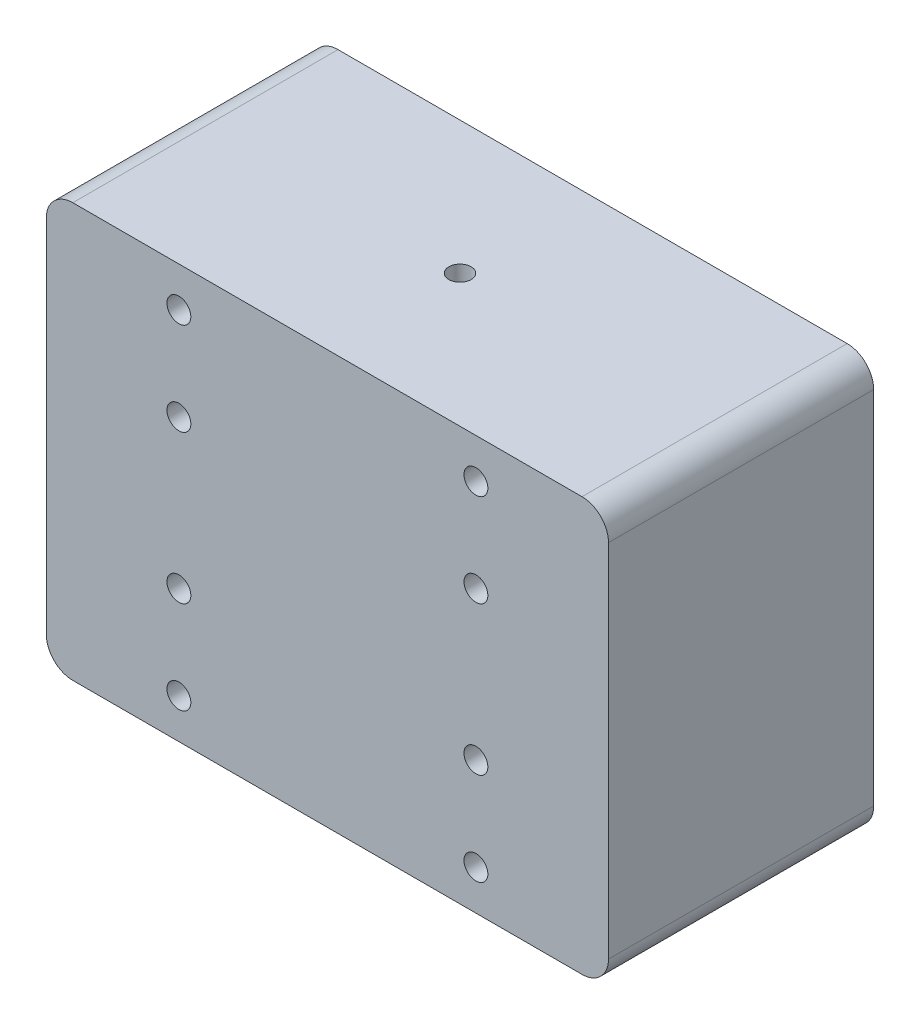
from build123d import *

# Parameters (mm, degrees)
SKETCH1_W            = 106
SKETCH1_H            = 78
BOSS_EXTRUDE1_DEPTH  = 50
HOLEWZD1_D           = 4.5
HOLEWZD2_D           = 4.2
HOLEWZD2_DEPTH       = 30
HOLEWZD4_D           = 20
HOLEWZD4_DEPTH       = 20
HOLEWZD4_CSINK_D     = 22
HOLEWZD4_CSINK_ANGLE = 90
HOLEWZD5_AT_2_COUNT  = 2
HOLEWZD5_AT_2_PITCH  = 28
HOLEWZD5_AT_3_COUNT  = 2
HOLEWZD5_AT_3_PITCH  = 56
HOLEWZD5_AT_4_COUNT  = 2
HOLEWZD5_AT_4_PITCH  = 62.60990337
HOLEWZD6_D           = 16
HOLEWZD6_DEPTH       = 45
HOLEWZD6_CSINK_D     = 19
HOLEWZD6_CSINK_ANGLE = 90
CHAMFER1_SIZE        = 1.5
FILLET1_R            = 5


# Read off the part's stored shape, not the designer's step: HoleWzd3
with BuildPart() as part:
    # Sketch1 → Boss-Extrude1 (new body)
    with BuildSketch(Plane(origin=(0, 0, 0), x_dir=(-1, 0, 0), z_dir=(0, 0, -1))):
        with Locations((-42, 28)):
            Rectangle(SKETCH1_W, SKETCH1_H)
    extrude(amount=-BOSS_EXTRUDE1_DEPTH)

    # HoleWzd1 (through all)
    with Locations(Plane.XY.offset(50)):
        with Locations((14, 59.5), (70, -3.5), (14, -3.5), (70, 59.5)):
            Hole(HOLEWZD1_D / 2)

    # HoleWzd2
    with Locations(Plane(origin=(0, 67, 0), x_dir=(1, 0, 0), z_dir=(0, 1, 0))):
        with Locations((42, -25)):
            Hole(HOLEWZD2_D / 2, depth=HOLEWZD2_DEPTH)

    # HoleWzd3 outline → HoleWzd3 (revolve, cut)
    with BuildSketch(Plane(origin=(42, 50, 0), x_dir=(1, 0, 0), z_dir=(0, -1, 0))):
        Polygon((0, 14.648924226), (1.25, 15.4), (1.25, 23.312743137), (0, 23.312743137), align=None)
    revolve(axis=Axis((42, 50, 0), (0, 0, 1)), mode=Mode.SUBTRACT)

    # HoleWzd4
    with Locations(Plane(origin=(0, 0, 0), x_dir=(-1, 0, 0), z_dir=(0, 0, -1))):
        with Locations((-42, 14), (-42, 42)):
            CounterSinkHole(HOLEWZD4_D / 2, HOLEWZD4_CSINK_D / 2, depth=HOLEWZD4_DEPTH, counter_sink_angle=HOLEWZD4_CSINK_ANGLE)

    # Sketch9 → HoleWzd5 (revolve, cut)
    with BuildSketch(Plane(origin=(70, 42, 0), x_dir=(0, 1, 0), z_dir=(1, 0, 0))):
        Polygon((0, 0), (0, 50), (2.25, 50), (2.25, 20), (10, 20), (10, 1), (11, 0), align=None)
    holewzd5 = revolve(axis=Axis((70, 42, -6.35), (0, 0, 1)), mode=Mode.SUBTRACT)

    # HoleWzd5 at 2: HoleWzd5 ×2
    with Locations(*[(0, -i * HOLEWZD5_AT_2_PITCH, 0) for i in range(1, HOLEWZD5_AT_2_COUNT)]):
        add(holewzd5, mode=Mode.SUBTRACT)

    # HoleWzd5 at 3: HoleWzd5 ×2
    with Locations(*[(-i * HOLEWZD5_AT_3_PITCH, 0, 0) for i in range(1, HOLEWZD5_AT_3_COUNT)]):
        add(holewzd5, mode=Mode.SUBTRACT)

    # HoleWzd5 at 4: HoleWzd5 ×2
    with Locations(*[Vector(-0.894427190999916, -0.447213595499958, 0) * (i * HOLEWZD5_AT_4_PITCH) for i in range(1, HOLEWZD5_AT_4_COUNT)]):
        add(holewzd5, mode=Mode.SUBTRACT)

    # HoleWzd6
    with Locations(Plane(origin=(0, 0, 0), x_dir=(-1, 0, 0), z_dir=(0, 0, -1))):
        with Locations((-84, 56), (-84, 28), (-56, 56), (-56, 0), (-84, 0), (-28, 28), (-28, 56), (-56, 28), (-28, 0), (0, 28), (0, 0), (0, 56)):
            CounterSinkHole(HOLEWZD6_D / 2, HOLEWZD6_CSINK_D / 2, depth=HOLEWZD6_DEPTH, counter_sink_angle=HOLEWZD6_CSINK_ANGLE)

    # Chamfer1
    chamfer1_edges = [part.edges().sort_by_distance(p)[0] for p in [
        (48, 0, 45),
    ]]
    chamfer(chamfer1_edges, length=CHAMFER1_SIZE)

    # Fillet1
    fillet1_edges = [part.edges().sort_by_distance(p)[0] for p in [
        (95, -11, 25),
        (95, 67, 25),
        (-11, 67, 25),
        (-11, -11, 25),
    ]]
    fillet(fillet1_edges, radius=FILLET1_R)


solid = part.part
